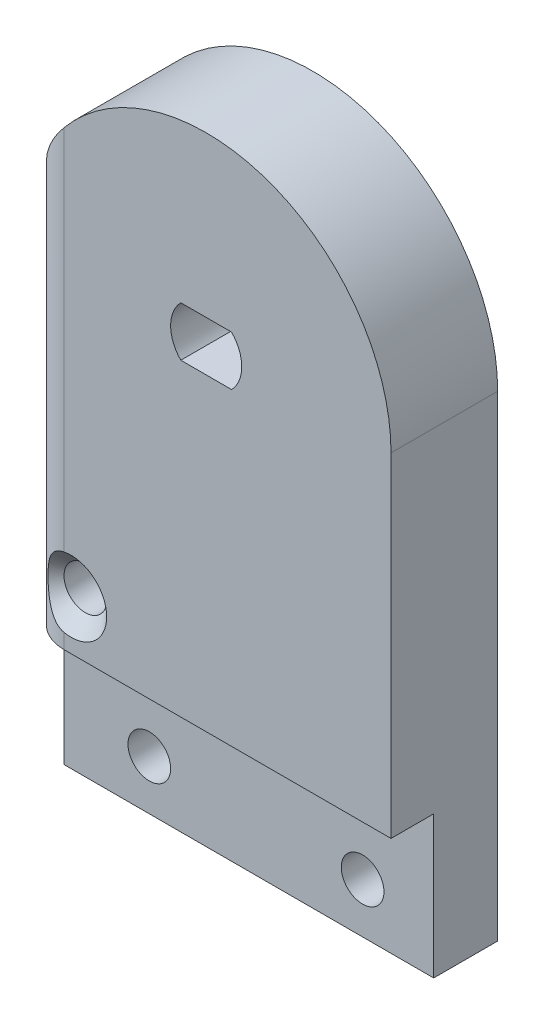
from build123d import *

# Parameters (mm, degrees)
SKETCH1_W           = 26
SKETCH1_H           = 50
BOSS_EXTRUDE1_DEPTH = 8
SKETCH2_W           = 26
SKETCH2_H           = 50
BOSS_EXTRUDE2_DEPTH = 8
SKETCH3_W           = 26
SKETCH3_H           = 7
BOSS_EXTRUDE3_DEPTH = 36
SKETCH4_R           = 8
SKETCH4_R_2         = 5
BOSS_EXTRUDE4_DEPTH = 10
FILLET2_R           = 3
SKETCH6_W           = 7
SKETCH6_H           = 17
BOSS_EXTRUDE5_DEPTH = 20
CHAMFER1_SIZE       = 2
CUT_EXTRUDE2_DEPTH  = 0.5
CUT_EXTRUDE3_DEPTH  = 0.5
CUT_EXTRUDE4_REACH  = 90.986
SKETCH11_W          = 26
SKETCH11_H          = 10
CUT_EXTRUDE5_DEPTH  = 3
SKETCH12_W          = 26
SKETCH12_H          = 10
CUT_EXTRUDE6_DEPTH  = 3
CUT_EXTRUDE7_REACH  = 90.986
SKETCH13_R          = 1.5
SKETCH14_W          = 39.670907723
SKETCH14_H          = 70.738486061
CUT_EXTRUDE8_DEPTH  = 8
SKETCH15_W          = 26
SKETCH15_H          = 39.127202372
CUT_EXTRUDE9_DEPTH  = 28.5


with BuildPart() as part:
    # Sketch1 → Boss-Extrude1 (new body)
    with BuildSketch(Plane.XY):
        with Locations((37.264100782, -29)):
            Rectangle(SKETCH1_W, SKETCH1_H)
        with BuildLine():
            Line((39.049457889, -22.265997948), (35.478743675, -22.265997948))
            ThreePointArc((35.478743675, -22.265997948), (34.764100782, -20.515997948), (35.478743675, -18.765997947))
            Line((35.478743675, -18.765997947), (39.049457889, -18.765997947))
            ThreePointArc((39.049457889, -18.765997947), (39.764100782, -20.515997948), (39.049457889, -22.265997948))
        make_face(mode=Mode.SUBTRACT)
    extrude(amount=BOSS_EXTRUDE1_DEPTH)



with BuildPart() as body_2:
    # Sketch2 → Boss-Extrude2 (new body)
    with BuildSketch(Plane(origin=(0, 0, -20), x_dir=(-1, 0, 0), z_dir=(0, 0, -1))):
        with Locations((-37.264100782, -29)):
            Rectangle(SKETCH2_W, SKETCH2_H)
        with BuildLine():
            Line((-39.049457889, -18.765997947), (-35.478743675, -18.765997947))
            ThreePointArc((-35.478743675, -18.765997947), (-34.764100782, -20.515997948), (-35.478743675, -22.265997948))
            Line((-35.478743675, -22.265997948), (-39.049457889, -22.265997948))
            ThreePointArc((-39.049457889, -22.265997948), (-39.764100782, -20.515997948), (-39.049457889, -18.765997947))
        make_face(mode=Mode.SUBTRACT)
    extrude(amount=BOSS_EXTRUDE2_DEPTH)


with BuildPart() as part_1:
    add(part.part)

    add(body_2.part)  # Boss-Extrude3 merges body 2
    # Sketch3 → Boss-Extrude3 (add)
    with BuildSketch(Plane.XY.offset(8)):
        with Locations((37.264100782, -50.5)):
            Rectangle(SKETCH3_W, SKETCH3_H)
    extrude(amount=-BOSS_EXTRUDE3_DEPTH)

    # Sketch4 → Boss-Extrude4 (add)
    with BuildSketch(Plane.XZ.offset(54)):
        with Locations(Location((37.264100782, -10, 0), (0, 0, 90))):
            Circle(SKETCH4_R)
        with Locations(Location((37.264100782, -10, 0), (0, 0, 270))):
            Circle(SKETCH4_R_2, mode=Mode.SUBTRACT)
    extrude(amount=BOSS_EXTRUDE4_DEPTH)

    # Fillet2
    fillet2_edges = [part_1.edges().sort_by_distance(p)[0] for p in [
        (24.264100782, -29, 8),
        (24.264100782, -29, -28),
    ]]
    fillet(fillet2_edges, radius=FILLET2_R)

    # Sketch6 → Boss-Extrude5 (add)
    with BuildSketch(Plane.XY.offset(-20)):
        with Locations((27.764100782, -45.5)):
            Rectangle(SKETCH6_W, SKETCH6_H)
    extrude(amount=BOSS_EXTRUDE5_DEPTH)

    # Chamfer1
    chamfer1_edges = [part_1.edges().sort_by_distance(p)[0] for p in [
        (37.264100782, -54, -18),
    ]]
    chamfer(chamfer1_edges, length=CHAMFER1_SIZE)

    # Sketch7 → Cut-Extrude2 (cut)
    with BuildSketch(Plane(origin=(0, 0, 0), x_dir=(-1, 0, 0), z_dir=(0, 0, -1))):
        Polygon((-50.264100782, -4), (-50.264100782, -47), (-31.264100782, -47), (-31.264100782, -37), (-24.264100782, -37), (-24.264100782, -4), align=None)
    extrude(amount=-CUT_EXTRUDE2_DEPTH, mode=Mode.SUBTRACT)

    # Sketch8 → Cut-Extrude3 (cut)
    with BuildSketch(Plane.XY.offset(-20)):
        Polygon((50.264100782, -47), (50.264100782, -4), (24.264100782, -4), (24.264100782, -37), (31.264100782, -37), (31.264100782, -47), align=None)
    extrude(amount=-CUT_EXTRUDE3_DEPTH, mode=Mode.SUBTRACT)

    # Cut-Extrude4: up to this face of the body (flat: up to its plane)
    cut_extrude4_end = Plane(part_1.part.faces().sort_by_distance((38.785185957, -29.119257779, -28))[0])
    # Sketch10 → Cut-Extrude4 (cut, up to the picked face)
    with BuildSketch(Plane.XY.offset(8), mode=Mode.PRIVATE) as cut_extrude4_sk1:
        with BuildLine():
            Line((50.264100782, -20.515997948), (50.264100782, 2.26582648))
            Line((50.264100782, 2.26582648), (24.264100782, 2.26582648))
            Line((24.264100782, 2.26582648), (24.264100782, -20.515997948))
            ThreePointArc((24.264100782, -20.515997948), (37.264100782, -7.515997948), (50.264100782, -20.515997948))
        make_face()
    cut_extrude4_tool1 = split(extrude(cut_extrude4_sk1.sketch, amount=-CUT_EXTRUDE4_REACH, mode=Mode.PRIVATE), bisect_by=cut_extrude4_end, keep=Keep.BOTH, mode=Mode.PRIVATE)
    add(cut_extrude4_tool1.solids().sort_by(Axis((37.264101, -4.354837, 8), (0, 0, -1)))[0], mode=Mode.SUBTRACT)

    # Sketch11 → Cut-Extrude5 (cut)
    with BuildSketch(Plane.XY.offset(8)):
        with Locations((37.264100782, -49)):
            Rectangle(SKETCH11_W, SKETCH11_H)
    extrude(amount=-CUT_EXTRUDE5_DEPTH, mode=Mode.SUBTRACT)

    # Sketch12 → Cut-Extrude6 (cut)
    with BuildSketch(Plane(origin=(0, 0, -28), x_dir=(-1, 0, 0), z_dir=(0, 0, -1))):
        with Locations((-37.264100782, -49)):
            Rectangle(SKETCH12_W, SKETCH12_H)
    extrude(amount=-CUT_EXTRUDE6_DEPTH, mode=Mode.SUBTRACT)

    # Cut-Extrude7: up to this face of the body (flat: up to its plane)
    cut_extrude7_end = Plane(part_1.part.faces().sort_by_distance((38.560022368, -26.898937337, -28))[0])
    # Sketch13 → Cut-Extrude7 (cut, up to the picked face)
    with BuildSketch(Plane.XY.offset(8), mode=Mode.PRIVATE) as cut_extrude7_sk1:
        with Locations((45.264100782, -50.5)):
            Circle(SKETCH13_R)
    cut_extrude7_tool1 = split(extrude(cut_extrude7_sk1.sketch, amount=-CUT_EXTRUDE7_REACH, mode=Mode.PRIVATE), bisect_by=cut_extrude7_end, keep=Keep.BOTH, mode=Mode.PRIVATE)
    # Sketch13 → Cut-Extrude7 (cut, up to the picked face)
    with BuildSketch(Plane.XY.offset(8), mode=Mode.PRIVATE) as cut_extrude7_sk2:
        with Locations((30.264100782, -50.5)):
            Circle(SKETCH13_R)
    cut_extrude7_tool2 = split(extrude(cut_extrude7_sk2.sketch, amount=-CUT_EXTRUDE7_REACH, mode=Mode.PRIVATE), bisect_by=cut_extrude7_end, keep=Keep.BOTH, mode=Mode.PRIVATE)
    # Sketch13 → Cut-Extrude7 (cut, up to the picked face)
    with BuildSketch(Plane.XY.offset(8), mode=Mode.PRIVATE) as cut_extrude7_sk3:
        with Locations(Location((27.764100782, -40.5, 0), (0, 0, 109.471220634))):
            Circle(SKETCH13_R)
    cut_extrude7_tool3 = split(extrude(cut_extrude7_sk3.sketch, amount=-CUT_EXTRUDE7_REACH, mode=Mode.PRIVATE), bisect_by=cut_extrude7_end, keep=Keep.BOTH, mode=Mode.PRIVATE)
    add(cut_extrude7_tool1.solids().sort_by(Axis((45.264101, -50.5, 8), (0, 0, -1)))[0], mode=Mode.SUBTRACT)
    add(cut_extrude7_tool2.solids().sort_by(Axis((30.264101, -50.5, 8), (0, 0, -1)))[0], mode=Mode.SUBTRACT)
    add(cut_extrude7_tool3.solids().sort_by(Axis((27.764101, -40.5, 8), (0, 0, -1)))[0], mode=Mode.SUBTRACT)

    # Sketch14 → Cut-Extrude8 (cut)
    with BuildSketch(Plane(origin=(0, 0, -28), x_dir=(-1, 0, 0), z_dir=(0, 0, -1))):
        with Locations((-35.76618016, -37.229796089)):
            Rectangle(SKETCH14_W, SKETCH14_H)
    extrude(amount=-CUT_EXTRUDE8_DEPTH, mode=Mode.SUBTRACT)

    # Chamfer2: read off the stored shape, not the designer's step
    # Chamfer2 outline → Chamfer2 (revolve, cut)
    with BuildSketch(Plane(origin=(27.764100782, -40.5, 0), x_dir=(1, 0, 0), z_dir=(0, -1, 0))):
        Polygon((1.5, 8.000002987), (1.5, 7), (2.500002987, 8.000002987), align=None)
    revolve(axis=Axis((27.764100782, -40.5, 0), (0, 0, 1)), mode=Mode.SUBTRACT)

    # Sketch15 → Cut-Extrude9 (cut)
    with BuildSketch(Plane(origin=(0, 0, 0.5), x_dir=(-1, 0, 0), z_dir=(0, 0, -1))):
        with Locations((-37.264100782, -56.563601186)):
            Rectangle(SKETCH15_W, SKETCH15_H)
    extrude(amount=CUT_EXTRUDE9_DEPTH, mode=Mode.SUBTRACT)


solid = part_1.part
